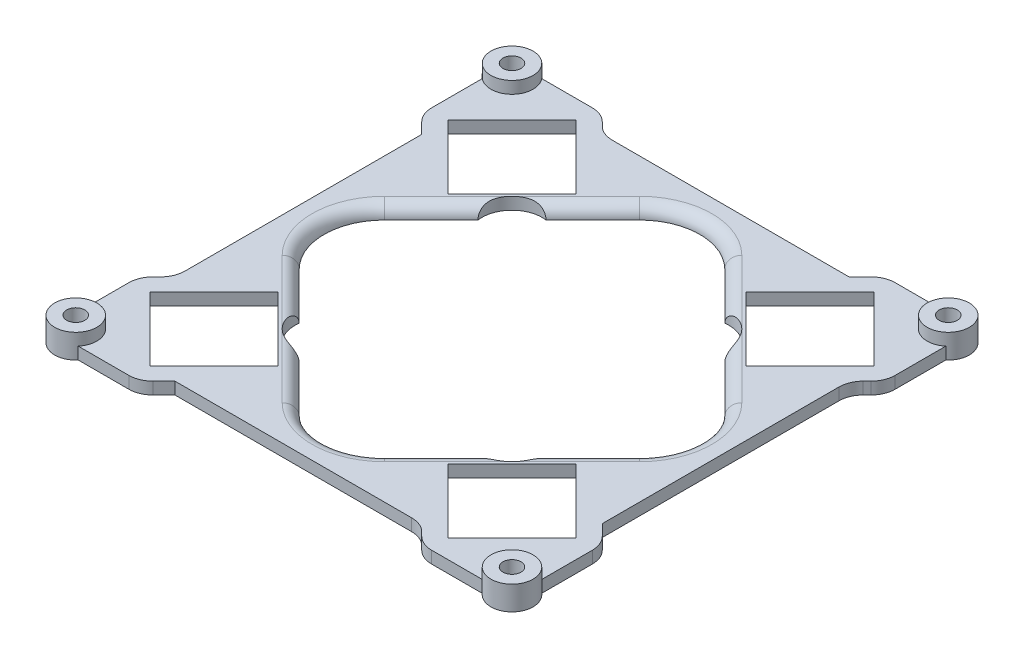
from build123d import *

# Parameters (mm, degrees)
SKETCH1_W           = 77
SKETCH1_H           = 77
BOSS_EXTRUDE1_DEPTH = 2
SKETCH3_R           = 3.5
BOSS_EXTRUDE2_DEPTH = 4
SKETCH5_R           = 1.5
CUT_EXTRUDE1_DEPTH  = 57.341917038
CUT_EXTRUDE3_DEPTH  = 5
CIRPATTERN3_COUNT   = 4
FILLET3_R           = 4
CUT_EXTRUDE5_DEPTH  = 5
SKETCH6_R           = 1.5
CUT_EXTRUDE6_DEPTH  = 57.341917038
FILLET4_R           = 10
SKETCH8_R           = 5
CUT_EXTRUDE7_DEPTH  = 10
FILLET5_R           = 2


with BuildPart() as part:
    # Sketch1 → Boss-Extrude1 (new body)
    with BuildSketch(Plane(origin=(0, 0, 0), x_dir=(1, 0, 0), z_dir=(0, 1, 0))):
        Rectangle(SKETCH1_W, SKETCH1_H)
        Polygon((14.142135624, 24.748737342), (24.748737342, 14.142135624), (35.355339059, 24.748737342), (24.748737342, 35.355339059), align=None, mode=Mode.SUBTRACT)
        Polygon((-24.748737342, 14.142135624), (-35.355339059, 24.748737342), (-24.748737342, 35.355339059), (-14.142135624, 24.748737342), align=None, mode=Mode.SUBTRACT)
        Polygon((-14.142135624, -24.748737342), (-24.748737342, -14.142135624), (-35.355339059, -24.748737342), (-24.748737342, -35.355339059), align=None, mode=Mode.SUBTRACT)
        Polygon((14.142135624, -24.748737342), (24.748737342, -14.142135624), (35.355339059, -24.748737342), (24.748737342, -35.355339059), align=None, mode=Mode.SUBTRACT)
    extrude(amount=BOSS_EXTRUDE1_DEPTH)

    # Sketch3 → Boss-Extrude2 (add)
    with BuildSketch(Plane(origin=(0, 0, 0), x_dir=(1, 0, 0), z_dir=(0, 1, 0))):
        with Locations(Location((-36.239222536, 36.239222536, 0), (0, 0, 40.235921257))):
            Circle(SKETCH3_R)
        with Locations(Location((36.239222536, 36.239222536, 0), (0, 0, 139.764078743))):
            Circle(SKETCH3_R)
        with Locations(Location((-36.239222536, -36.239222536, 0), (0, 0, 130.235921257))):
            Circle(SKETCH3_R)
        with Locations(Location((36.239222536, -36.239222536, 0), (0, 0, 49.764078743))):
            Circle(SKETCH3_R)
    extrude(amount=BOSS_EXTRUDE2_DEPTH)

    # Sketch5 → Cut-Extrude1 (cut, through all)
    with BuildSketch(Plane(origin=(0, 0, 0), x_dir=(1, 0, 0), z_dir=(0, 1, 0))):
        with Locations(Location((0, 0, 0), (0, 0, 270))):
            Circle(SKETCH5_R)
    extrude(amount=CUT_EXTRUDE1_DEPTH, mode=Mode.SUBTRACT)

    # Sketch4 → Cut-Extrude3 (cut)
    with BuildSketch(Plane(origin=(0, 0, 0), x_dir=(1, 0, 0), z_dir=(0, 1, 0))):
        Polygon((-38.5, 23.5), (-38.5, -23.5), (-35.5, -20.5), (-35.5, 20.5), align=None)
    cut_extrude3 = extrude(amount=CUT_EXTRUDE3_DEPTH, mode=Mode.SUBTRACT)

    # CirPattern3: Cut-Extrude3 ×4 about axis
    cirpattern3_axis = Axis((0, 0, 0), (0, 1, 0))
    for i in range(1, CIRPATTERN3_COUNT):
        add(cut_extrude3.rotate(cirpattern3_axis, i * 360 / CIRPATTERN3_COUNT), mode=Mode.SUBTRACT)

    # Fillet3
    fillet3_edges = [part.edges().sort_by_distance(p)[0] for p in [
        (-38.5, 1, -23.5),
        (-38.5, 1, 23.5),
        (-35.5, 1, 20.5),
        (-23.5, 1, -38.5),
        (23.5, 1, -38.5),
        (-20.5, 1, -35.5),
        (38.5, 1, -23.5),
        (38.5, 1, 23.5),
        (35.5, 1, -20.5),
        (23.5, 1, 38.5),
        (-23.5, 1, 38.5),
        (20.5, 1, 35.5),
    ]]
    fillet(fillet3_edges, radius=FILLET3_R)

    # Sketch2 → Cut-Extrude5 (cut)
    with BuildSketch(Plane(origin=(0, 0, 0), x_dir=(1, 0, 0), z_dir=(0, 1, 0))):
        Polygon((35.355339059, 0), (0, 35.355339059), (-35.355339059, 0), (0, -35.355339059), align=None)
    extrude(amount=CUT_EXTRUDE5_DEPTH, mode=Mode.SUBTRACT)

    # Sketch6 → Cut-Extrude6 (cut, through all)
    with BuildSketch(Plane(origin=(0, 0, 0), x_dir=(1, 0, 0), z_dir=(0, 1, 0))):
        with Locations(Location((-36.239222536, 36.239222536, 0), (0, 0, 270))):
            Circle(SKETCH6_R)
        with Locations(Location((-36.239222536, -36.239222536, 0), (0, 0, 270))):
            Circle(SKETCH6_R)
        with Locations(Location((36.239222536, -36.239222536, 0), (0, 0, 270))):
            Circle(SKETCH6_R)
        with Locations(Location((36.239222536, 36.239222536, 0), (0, 0, 270))):
            Circle(SKETCH6_R)
    extrude(amount=CUT_EXTRUDE6_DEPTH, mode=Mode.SUBTRACT)

    # Fillet4
    fillet4_edges = [part.edges().sort_by_distance(p)[0] for p in [
        (0, 1, 35.355339059),
        (35.355339059, 1, 0),
        (0, 1, -35.355339059),
        (-35.355339059, 1, 0),
    ]]
    fillet(fillet4_edges, radius=FILLET4_R)

    # Sketch8 → Cut-Extrude7 (cut)
    with BuildSketch(Plane(origin=(0, 2, 0), x_dir=(1, 0, 0), z_dir=(0, 1, 0))):
        with Locations((15.556349186, 15.556349186)):
            Circle(SKETCH8_R)
        with Locations((-15.556349186, 15.556349186)):
            Circle(SKETCH8_R)
        with Locations((-15.556349186, -15.556349186)):
            Circle(SKETCH8_R)
        with Locations((15.556349186, -15.556349186)):
            Circle(SKETCH8_R)
    extrude(amount=-CUT_EXTRUDE7_DEPTH, mode=Mode.SUBTRACT)

    # Fillet5
    fillet5_edges = [part.edges().sort_by_distance(p)[0] for p in [
        (-24.395183951, 2, 10.960155108),
        (-24.395183951, 2, -10.960155108),
        (10.960155108, 2, 24.395183951),
        (-10.960155108, 2, 24.395183951),
        (24.395183951, 2, -10.960155108),
        (24.395183951, 2, 10.960155108),
        (-10.960155108, 2, -24.395183951),
        (10.960155108, 2, -24.395183951),
        (-31.213203436, 2, 0),
        (0, 2, 31.213203436),
        (31.213203436, 2, 0),
        (0, 2, -31.213203436),
    ]]
    fillet(fillet5_edges, radius=FILLET5_R - 0.0001)  # a hair under: the kernel refuses the full size


solid = part.part
